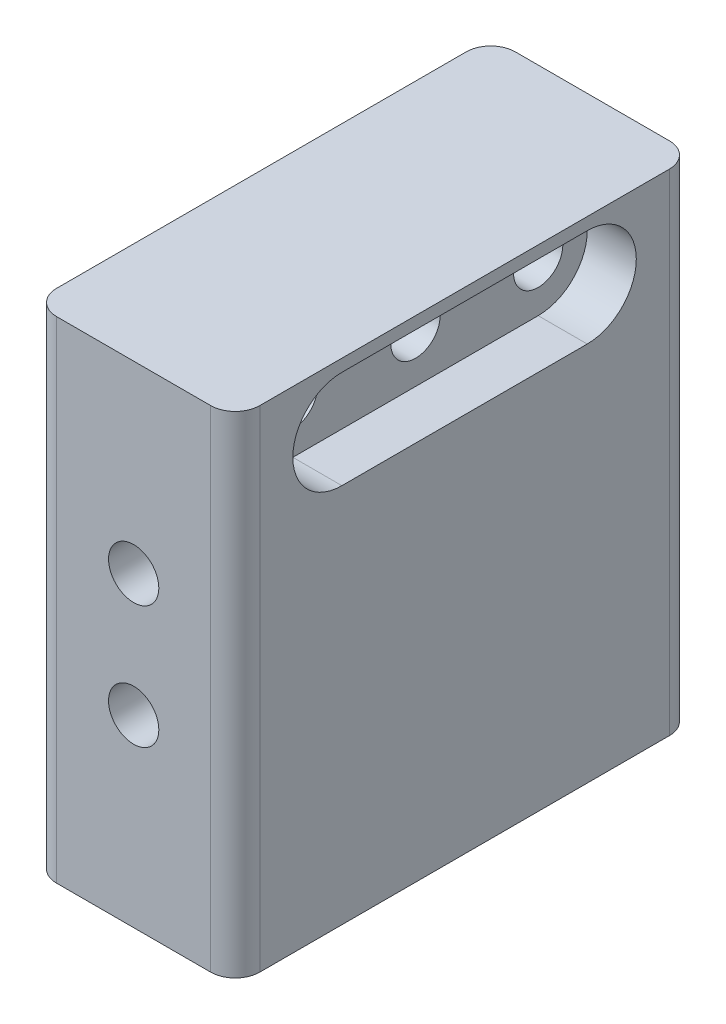
from build123d import *

# Parameters (mm, degrees)
SKETCH1_W           = 21.0312
SKETCH1_H           = 47.4853
BOSS_EXTRUDE1_DEPTH = 25.4
SKETCH2_R           = 2.6035
CUT_EXTRUDE1_DEPTH  = 55.868857829
SKETCH4_R           = 2.5527
CUT_EXTRUDE3_DEPTH  = 41.634773316
FILLET1_R           = 2.54
CUT_EXTRUDE5_DEPTH  = 5.08


with BuildPart() as part:
    # Sketch1 → Boss-Extrude1 (new, symmetric)
    with BuildSketch(Plane(origin=(0, 0, 0), x_dir=(1, 0, 0), z_dir=(0, 1, 0))):
        Rectangle(SKETCH1_W, SKETCH1_H)
    extrude(amount=BOSS_EXTRUDE1_DEPTH, both=True)

    # Sketch2 → Cut-Extrude1 (cut, through all)
    with BuildSketch(Plane.XY.offset(23.74265)):
        with Locations((0, -6.35)):
            Circle(SKETCH2_R)
        with Locations((0, 6.35)):
            Circle(SKETCH2_R)
    extrude(amount=-CUT_EXTRUDE1_DEPTH, mode=Mode.SUBTRACT)

    # Sketch4 → Cut-Extrude3 (cut, through all)
    with BuildSketch(Plane(origin=(10.5156, 0, 0), x_dir=(0, 0, -1), z_dir=(1, 0, 0))):
        with Locations((-12.7, 19.05)):
            Circle(SKETCH4_R)
        with Locations((12.7, 19.05)):
            Circle(SKETCH4_R)
        with Locations((0, 19.05)):
            Circle(SKETCH4_R)
    extrude(amount=-CUT_EXTRUDE3_DEPTH, mode=Mode.SUBTRACT)

    # Fillet1
    fillet1_edges = [part.edges().sort_by_distance(p)[0] for p in [
        (10.5156, 0, 23.74265),
        (-10.5156, 0, 23.74265),
        (-10.5156, 0, -23.74265),
        (10.5156, 0, -23.74265),
    ]]
    fillet(fillet1_edges, radius=FILLET1_R)

    # Sketch7 → Cut-Extrude5 (cut)
    with BuildSketch(Plane(origin=(10.5156, 0, 0), x_dir=(0, 0, -1), z_dir=(1, 0, 0))):
        with BuildLine():
            Line((-12.7, 24.13), (12.7, 24.13))
            ThreePointArc((12.7, 24.13), (17.78, 19.05), (12.7, 13.97))
            Line((12.7, 13.97), (-12.7, 13.97))
            ThreePointArc((-12.7, 13.97), (-17.78, 19.05), (-12.7, 24.13))
        make_face()
    extrude(amount=-CUT_EXTRUDE5_DEPTH, mode=Mode.SUBTRACT)


solid = part.part
